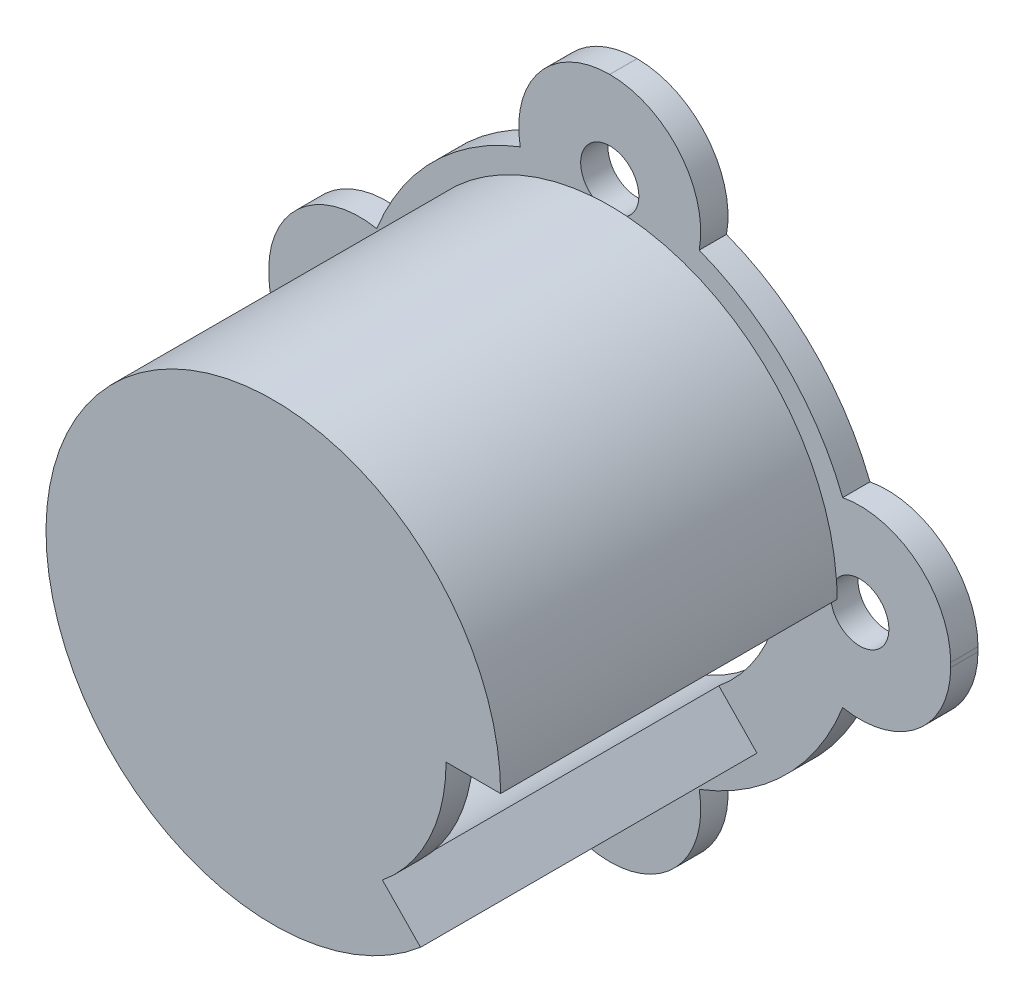
from build123d import *

# Parameters (mm, degrees)
ESQUISSE1_R                  = 25
BOSS_EXTRU_1_DEPTH           = 37
ENL_V_MAT_EXTRU_1_DEPTH      = 3
ENL_V_MAT_EXTRU_1_DEPTH_BACK = 34
ESQUISSE4_R                  = 19
ENL_V_MAT_EXTRU_3_DEPTH      = 52.176166328
ESQUISSE9_R                  = 37.5
BOSS_EXTRU_2_DEPTH           = 3
ENL_V_START                  = 3
ESQUISSE4_2_R                = 19
ENL_V_MAT_EXTRU_4_DEPTH      = 3
D_GAGEMENT_M61_D             = 6.4
D_GAGEMENT_M61_DEPTH         = 3
ENL_V_START_2                = -3
ENL_V_MAT_EXTRU_5_DEPTH      = 3
CONG_1_R                     = 10
CONG_1_OF_SYM_TRIE4_R        = 10
SYM_TRIE5_START              = -3
SYM_TRIE5_DEPTH              = 3


# Read off the part's stored shape, not the designer's step: Symétrie5
with BuildPart() as part:
    # Esquisse1 → Boss.-Extru.1 (new body)
    with BuildSketch(Plane.XY):
        Circle(ESQUISSE1_R)
    extrude(amount=BOSS_EXTRU_1_DEPTH)

    # Esquisse4 → Enlèv. mat.-Extru.1 (cut, two sides: drawn at the far end of the back side and taken through both)
    with BuildSketch(Plane(origin=(0, 0, 0), x_dir=(-1, 0, 0), z_dir=(0, 0, -1)).offset(-ENL_V_MAT_EXTRU_1_DEPTH_BACK)):
        with Locations(Location((0, 0, 0), (0, 0, 180))):
            Circle(ESQUISSE4_R)
    extrude(amount=ENL_V_MAT_EXTRU_1_DEPTH + ENL_V_MAT_EXTRU_1_DEPTH_BACK, mode=Mode.SUBTRACT)

    # Esquisse7 → Enlèv. mat.-Extru.3 (cut, through all)
    with BuildSketch(Plane(origin=(0, 0, 0), x_dir=(-1, 0, 0), z_dir=(0, 0, -1))):
        with BuildLine():
            Line((-16.192810305, -19.047122996), (-11.999578126, -14.731263517))
            ThreePointArc((-11.999578126, -14.731263517), (-17.160885531, -8.154998946), (-19, 0))
            Line((-19, 0), (-25, 0))
            ThreePointArc((-25, 0), (-22.69163125, -10.492372048), (-16.192810305, -19.047122996))
        make_face()
    extrude(amount=-ENL_V_MAT_EXTRU_3_DEPTH, mode=Mode.SUBTRACT)

    # Esquisse9 → Boss.-Extru.2 (add)
    with BuildSketch(Plane(origin=(0, 0, 0), x_dir=(-1, 0, 0), z_dir=(0, 0, -1))):
        Circle(ESQUISSE9_R)
    extrude(amount=BOSS_EXTRU_2_DEPTH)

    # Esquisse4<2> → Enlèv. mat.-Extru.4 (cut)
    with BuildSketch(Plane(origin=(0, 0, 0), x_dir=(-1, 0, 0), z_dir=(0, 0, -1)).offset(ENL_V_START)):
        with Locations(Location((0, 0, 0), (0, 0, 180))):
            Circle(ESQUISSE4_2_R)
    extrude(amount=-ENL_V_MAT_EXTRU_4_DEPTH, mode=Mode.SUBTRACT)

    # Dégagement M61
    with Locations(Plane(origin=(0, 0, -3), x_dir=(-1, 0, 0), z_dir=(0, 0, -1))):
        with Locations((0, 27.5), (27.5, 0), (0, -27.5), (-27.5, 0)):
            Hole(D_GAGEMENT_M61_D / 2, depth=D_GAGEMENT_M61_DEPTH)

    # Esquisse15 → Enlèv. mat.-Extru.5 (cut)
    with BuildSketch(Plane(origin=(0, 0, -3), x_dir=(-1, 0, 0), z_dir=(0, 0, -1)).offset(ENL_V_START_2)):
        with BuildLine():
            Line((34.932786702, 13.636363636), (25.617376915, 10))
            ThreePointArc((25.617376915, 10), (19.384796538, 19.505887911), (9.840281362, 25.679152297))
            Line((9.840281362, 25.679152297), (12.051640076, 35.51067405))
            ThreePointArc((12.051640076, 35.51067405), (25.913422274, 27.106171734), (34.932786702, 13.636363636))
        make_face()
    enl_v_mat_extru_5 = extrude(amount=ENL_V_MAT_EXTRU_5_DEPTH, mode=Mode.SUBTRACT)

    # Congé1
    # the kernel refuses this fillet: 10 mm, written as the material it takes off along each edge
    with BuildSketch(Plane(origin=(-12.051640076, 35.51067405, 30.511737931), x_dir=(0.9866266204606564, 0.16299666192405335, 0), z_dir=(0, 0, -1))) as cong_1_piece_1:
        with BuildLine():
            CenterArc((10.577402483, 9.866707582), CONG_1_R, 178.889666711, 100.475681696)
            Line((0.579280147, 10.060485169), (0.3793177, 10.064360721))
            ThreePointArc((0.3793177, 10.064360721), (0.089970794, 5.04173949), (-0.199669279, 0.011496906))
            Line((-0.199669279, 0.011496906), (-0.032545854, -0.197334152))
            ThreePointArc((-0.032545854, -0.197334152), (6.102347586, -0.699846569), (12.237241026, -0.197334152))
            Line((12.237241026, -0.197334152), (12.204695172, 0))
        make_face()
    extrude(amount=64.023475862, mode=Mode.SUBTRACT)
    with BuildSketch(Plane(origin=(-34.932786702, 13.636363636, 34.090909091), x_dir=(-0.18820424606330075, -0.9821299108385533, 0), z_dir=(0, 0, -1))) as cong_1_piece_2:
        with BuildLine():
            CenterArc((11.818181818, -9.83332166), CONG_1_R, 79.524318304, 100.475681696)
            Line((1.818181818, -9.83332166), (1.618181818, -9.83332166))
            ThreePointArc((1.618181818, -9.83332166), (0.712424476, -4.953024467), (-0.196666433, -0.036363636))
            Line((-0.196666433, -0.036363636), (-0.036363636, 0.196666433))
            ThreePointArc((-0.036363636, 0.196666433), (6.818181818, 0.825043774), (13.672727273, 0.196666433))
            Line((13.672727273, 0.196666433), (13.636363636, 0))
        make_face()
    extrude(amount=71.181818182, mode=Mode.SUBTRACT)

    # Symétrie4: Enlèv. mat.-Extru.5 across plane
    add(enl_v_mat_extru_5.mirror(Plane(origin=(0, 0, 0), x_dir=(0, 0, 1), z_dir=(1, 0, 0))), mode=Mode.SUBTRACT)

    # Congé1 of Symétrie4
    # the kernel refuses this fillet: 10 mm, written as the material it takes off along each edge
    with BuildSketch(Plane(origin=(12.051640076, 35.51067405, 30.511737931), x_dir=(-0.9866266204606562, 0.1629966619240532, 0), z_dir=(0, 0, -1))) as cong_1_of_sym_trie4_piece_1:
        with BuildLine():
            CenterArc((10.577402483, -9.866707582), CONG_1_OF_SYM_TRIE4_R, 80.634651593, 100.475681696)
            Line((0.579280147, -10.060485169), (0.3793177, -10.064360721))
            ThreePointArc((0.3793177, -10.064360721), (0.089970794, -5.04173949), (-0.199669279, -0.011496906))
            Line((-0.199669279, -0.011496906), (-0.032545854, 0.197334152))
            ThreePointArc((-0.032545854, 0.197334152), (6.102347586, 0.699846569), (12.237241026, 0.197334152))
            Line((12.237241026, 0.197334152), (12.204695172, 0))
        make_face()
    extrude(amount=64.023475862, mode=Mode.SUBTRACT)
    with BuildSketch(Plane(origin=(34.932786702, 13.636363636, 34.090909091), x_dir=(0.18820424606330144, -0.982129910838553, 0), z_dir=(0, 0, -1))) as cong_1_of_sym_trie4_piece_2:
        with BuildLine():
            CenterArc((11.818181818, 9.83332166), CONG_1_OF_SYM_TRIE4_R, 180, 100.475681696)
            Line((1.818181818, 9.83332166), (1.618181818, 9.83332166))
            ThreePointArc((1.618181818, 9.83332166), (0.712424476, 4.953024467), (-0.196666433, 0.036363636))
            Line((-0.196666433, 0.036363636), (-0.036363636, -0.196666433))
            ThreePointArc((-0.036363636, -0.196666433), (6.818181818, -0.825043774), (13.672727273, -0.196666433))
            Line((13.672727273, -0.196666433), (13.636363636, 0))
        make_face()
    extrude(amount=71.181818182, mode=Mode.SUBTRACT)

    # Symétrie5 outline → Symétrie5 (cut)
    with BuildSketch(Plane.XY.offset(SYM_TRIE5_START)):
        with BuildLine():
            ThreePointArc((-0.010162924, -37.499998623), (-7.696247071, -33.893936965), (-9.840281362, -25.679152297))
            ThreePointArc((-9.840281362, -25.679152297), (-19.384796538, -19.505887911), (-25.617376915, -10))
            ThreePointArc((-25.617376915, -10), (-33.845353653, -7.907162456), (-37.499208239, -0.243683034))
            ThreePointArc((-37.499208239, -0.243683034), (-26.433813461, -26.59893806), (-0.010162924, -37.499998623))
        make_face()
        with BuildLine():
            ThreePointArc((9.840281362, -25.679152297), (7.696247071, -33.893936965), (0.010162924, -37.499998623))
            ThreePointArc((0.010162924, -37.499998623), (26.433813461, -26.59893806), (37.499208239, -0.243683034))
            ThreePointArc((37.499208239, -0.243683034), (33.845353653, -7.907162456), (25.617376915, -10))
            ThreePointArc((25.617376915, -10), (19.384796538, -19.505887911), (9.840281362, -25.679152297))
        make_face()
    extrude(amount=SYM_TRIE5_DEPTH, mode=Mode.SUBTRACT)


solid = part.part
